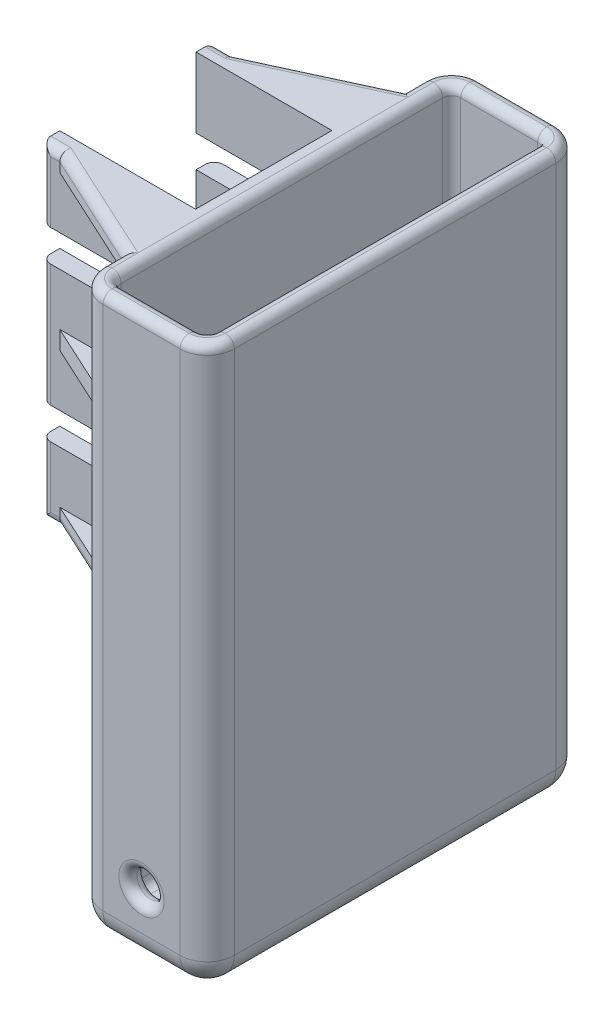
from build123d import *

# Parameters (mm, degrees)
EXTRUDE_1_DEPTH     = 120
EXTRUDE_2_DEPTH     = 4
FILLET_1_R          = 2
FILLET_2_R          = 6
SKETCH_3_W          = 30
SKETCH_3_H          = 4
EXTRUDE_3_DEPTH     = 72
EXTRUDE_4_DEPTH     = 2
EXTRUDE_5_DEPTH     = 4
CUT_EXTRUDE_1_DEPTH = 22
CUT_EXTRUDE_2_DEPTH = 4
SKETCH_8_R          = 3
CUT_EXTRUDE_3_DEPTH = 42
FILLET_3_R          = 2


with BuildPart() as part:
    # 스케치1 → 보스-돌출1 (new body)
    with BuildSketch(Plane(origin=(0, 0, 0), x_dir=(1, 0, 0), z_dir=(0, 1, 0))):
        with BuildLine():
            Line((6, 41.5), (23, 41.5))
            ThreePointArc((23, 41.5), (27.242640687, 39.742640687), (29, 35.5))
            Line((29, 35.5), (29, -35.5))
            ThreePointArc((29, -35.5), (27.242640687, -39.742640687), (23, -41.5))
            Line((23, -41.5), (6, -41.5))
            ThreePointArc((6, -41.5), (1.757359313, -39.742640687), (0, -35.5))
            Line((0, -35.5), (0, 35.5))
            ThreePointArc((0, 35.5), (1.757359313, 39.742640687), (6, 41.5))
        make_face()
        with BuildLine():
            Line((6, 37.5), (23, 37.5))
            ThreePointArc((23, 37.5), (24.414213562, 36.914213562), (25, 35.5))
            Line((25, 35.5), (25, -35.5))
            ThreePointArc((25, -35.5), (24.414213562, -36.914213562), (23, -37.5))
            Line((23, -37.5), (6, -37.5))
            ThreePointArc((6, -37.5), (4.585786438, -36.914213562), (4, -35.5))
            Line((4, -35.5), (4, 35.5))
            ThreePointArc((4, 35.5), (4.585786438, 36.914213562), (6, 37.5))
        make_face(mode=Mode.SUBTRACT)
    extrude(amount=-EXTRUDE_1_DEPTH)

    # 스케치2 → 보스-돌출2 (add)
    with BuildSketch(Plane.XZ.offset(120)):
        with BuildLine():
            Line((23, 41.5), (6, 41.5))
            ThreePointArc((6, 41.5), (1.757359313, 39.742640687), (0, 35.5))
            Line((0, 35.5), (0, -35.5))
            ThreePointArc((0, -35.5), (1.757359313, -39.742640687), (6, -41.5))
            Line((6, -41.5), (23, -41.5))
            ThreePointArc((23, -41.5), (27.242640687, -39.742640687), (29, -35.5))
            Line((29, -35.5), (29, 35.5))
            ThreePointArc((29, 35.5), (27.242640687, 39.742640687), (23, 41.5))
        make_face()
    extrude(amount=EXTRUDE_2_DEPTH)

    # 필렛1
    fillet_1_edges = [part.edges().sort_by_distance(p)[0] for p in [
        (24.414213562, -120, 36.914213562),
        (14.5, -120, 37.5),
        (4.585786438, -120, 36.914213562),
        (4, -120, 0),
        (4.585786438, -120, -36.914213562),
        (14.5, -120, -37.5),
        (24.414213562, -120, -36.914213562),
        (25, -120, 0),
    ]]
    fillet(fillet_1_edges, radius=FILLET_1_R)

    # 필렛2
    fillet_2_edges = [part.edges().sort_by_distance(p)[0] for p in [
        (27.242640687, -124, 39.742640687),
        (14.5, -124, 41.5),
        (1.757359313, -124, 39.742640687),
        (0, -124, 0),
        (1.757359313, -124, -39.742640687),
        (14.5, -124, -41.5),
        (27.242640687, -124, -39.742640687),
        (29, -124, 0),
    ]]
    fillet(fillet_2_edges, radius=FILLET_2_R)

    # 스케치3 → 보스-돌출3 (add)
    with BuildSketch(Plane(origin=(0, 0, 0), x_dir=(1, 0, 0), z_dir=(0, 1, 0))):
        with Locations((-15, 17.05)):
            Rectangle(SKETCH_3_W, SKETCH_3_H)
        with Locations((-15, -17.05)):
            Rectangle(SKETCH_3_W, SKETCH_3_H)
    extrude(amount=-EXTRUDE_3_DEPTH)

    # 스케치4 → 보스-돌출4 (add, symmetric)
    with BuildSketch(Plane(origin=(0, -36, 0), x_dir=(1, 0, 0), z_dir=(0, 1, 0))):
        Polygon((0, 31.05), (0, 19.05), (-26, 19.05), align=None)
        Polygon((0, -19.05), (-26, -19.05), (0, -31.05), align=None)
    extrude(amount=EXTRUDE_4_DEPTH, both=True)

    # 스케치5 → 보스-돌출5 (add)
    with BuildSketch(Plane(origin=(0, 0, 0), x_dir=(1, 0, 0), z_dir=(0, 1, 0))):
        Polygon((0, -31.05), (0, -19.05), (-26, -19.05), align=None)
        Polygon((0, 31.05), (-26, 19.05), (0, 19.05), align=None)
    extrude_5 = extrude(amount=-EXTRUDE_5_DEPTH)

    # 대칭 복사1: 보스-돌출5 across plane
    add(extrude_5.mirror(Plane.ZX.offset(-36)))

    # 스케치6 → 컷-돌출1 (cut, symmetric)
    with BuildSketch(Plane.XY):
        with BuildLine():
            Line((-15, -15.5), (-30, -15.5))
            Line((-30, -15.5), (-30, -22.5))
            Line((-30, -22.5), (-15, -22.5))
            ThreePointArc((-15, -22.5), (-11.5, -19), (-15, -15.5))
        make_face()
        with BuildLine():
            Line((-15, -49.5), (-30, -49.5))
            Line((-30, -49.5), (-30, -56.5))
            Line((-30, -56.5), (-15, -56.5))
            ThreePointArc((-15, -56.5), (-11.5, -53), (-15, -49.5))
        make_face()
    extrude(amount=CUT_EXTRUDE_1_DEPTH, both=True, mode=Mode.SUBTRACT)

    # 스케치7 → 컷-돌출2 (cut)
    with BuildSketch(Plane.XZ.offset(124)):
        with BuildLine():
            Line((17.5, 26), (17.5, -26))
            ThreePointArc((17.5, -26), (14.5, -29), (11.5, -26))
            Line((11.5, -26), (11.5, 26))
            ThreePointArc((11.5, 26), (14.5, 29), (17.5, 26))
        make_face()
    extrude(amount=-CUT_EXTRUDE_2_DEPTH, mode=Mode.SUBTRACT)

    # 스케치8 → 컷-돌출3 (cut, symmetric)
    with BuildSketch(Plane.XY):
        with Locations(Location((14.5, -109.5, 0), (0, 0, 180))):
            Circle(SKETCH_8_R)
    extrude(amount=CUT_EXTRUDE_3_DEPTH, both=True, mode=Mode.SUBTRACT)

    # 필렛3
    fillet_3_edges = [part.edges().sort_by_distance(p)[0] for p in [
        (24.414213562, 0, 36.914213562),
        (14.5, 0, 37.5),
        (4.585786438, 0, 36.914213562),
        (4, 0, 0),
        (4.585786438, 0, -36.914213562),
        (14.5, 0, -37.5),
        (24.414213562, 0, -36.914213562),
        (0, 0, 33.275),
        (1.757359313, 0, 39.742640687),
        (14.5, 0, 41.5),
        (27.242640687, 0, 39.742640687),
        (29, 0, 0),
        (27.242640687, 0, -39.742640687),
        (14.5, 0, -41.5),
        (1.757359313, 0, -39.742640687),
        (25, 0, 0),
        (0, 0, -33.275),
        (-13, -72, 25.05),
        (-28, -72, 19.05),
        (-13, -72, -25.05),
        (-28, -72, -19.05),
        (-13, 0, 25.05),
        (-28, 0, 19.05),
        (-28, 0, -19.05),
        (-13, 0, -25.05),
        (-30, -7.75, -19.05),
        (-30, -36, -19.05),
        (-30, -64.25, -19.05),
        (-30, -64.25, 19.05),
        (-30, -36, 19.05),
        (-30, -7.75, 19.05),
        (14.5, -120, -29),
        (11.5, -120, 0),
        (14.5, -120, 29),
        (14.5, -124, -29),
        (11.5, -124, 0),
        (14.5, -124, 29),
        (17.5, -120, 0),
        (17.5, -124, 0),
        (17.5, -109.5, -37.5),
        (17.5, -109.5, -41.5),
        (17.5, -109.5, 37.5),
        (17.5, -109.5, 41.5),
    ]]
    fillet(fillet_3_edges, radius=FILLET_3_R - 0.0001)  # a hair under: the kernel refuses the full size


solid = part.part
